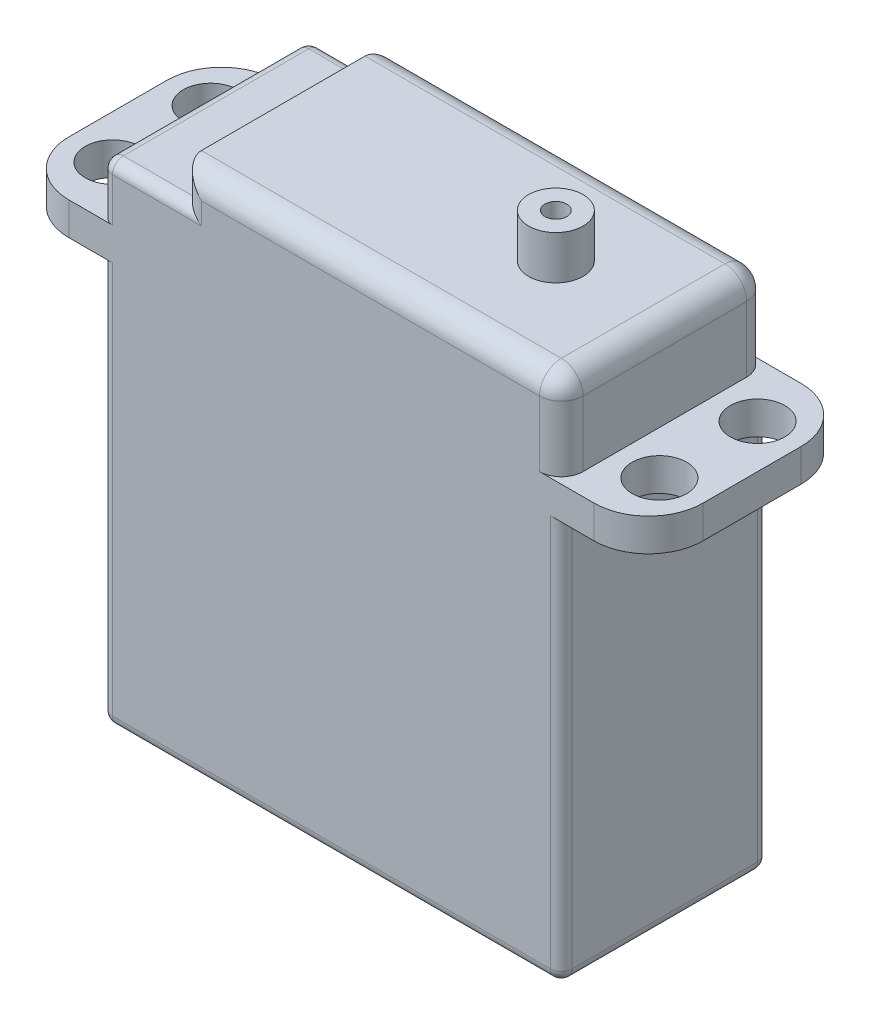
from build123d import *

# Parameters (mm, degrees)
SKETCH1_W           = 42.162271806
SKETCH1_H           = 37
SKETCH1_W_2         = 35
SKETCH1_H_2         = 3
BOSS_EXTRUDE1_DEPTH = 19
SKETCH2_R           = 2.5
CUT_EXTRUDE1_DEPTH  = 19
SKETCH4_R           = 2.5
SKETCH4_R_2         = 1
BOSS_EXTRUDE2_DEPTH = 4
FILLET1_R           = 2
FILLET2_R           = 2
FILLET3_R           = 5
FILLET4_R           = 1
FILLET5_R           = 1


with BuildPart() as part:
    # Sketch1 → Boss-Extrude1 (new body)
    with BuildSketch(Plane.XY):
        with Locations((3.738336714, 20.81643002)):
            Rectangle(SKETCH1_W, SKETCH1_H)
        Polygon((-25.342799189, 39.31643002), (-17.342799189, 39.31643002), (24.819472617, 39.31643002), (32.819472617, 39.31643002), (32.819472617, 42.31643002), (24.819472617, 42.31643002), (-17.342799189, 42.31643002), (-25.342799189, 42.31643002), align=None)
        Polygon((-17.342799189, 47.31643002), (-17.342799189, 42.31643002), (24.819472617, 42.31643002), (24.819472617, 47.31643002), (-10.180527383, 47.31643002), align=None)
        with Locations((7.319472617, 48.81643002)):
            Rectangle(SKETCH1_W_2, SKETCH1_H_2)
    extrude(amount=BOSS_EXTRUDE1_DEPTH)

    # Sketch2 → Cut-Extrude1 (cut)
    with BuildSketch(Plane(origin=(0, 42.31643002, 0), x_dir=(1, 0, 0), z_dir=(0, 1, 0))):
        with Locations(Location((-21.342799189, -14, 0), (0, 0, 270))):
            Circle(SKETCH2_R)
        with Locations(Location((-21.342799189, -5, 0), (0, 0, 270))):
            Circle(SKETCH2_R)
        with Locations(Location((28.819472617, -5, 0), (0, 0, 270))):
            Circle(SKETCH2_R)
        with Locations(Location((28.819472617, -14, 0), (0, 0, 270))):
            Circle(SKETCH2_R)
    extrude(amount=-CUT_EXTRUDE1_DEPTH, mode=Mode.SUBTRACT)

    # Sketch4 → Boss-Extrude2 (add)
    with BuildSketch(Plane(origin=(0, 50.31643002, 0), x_dir=(1, 0, 0), z_dir=(0, 1, 0))):
        with Locations(Location((14.819472617, -9.5, 0), (0, 0, 270))):
            Circle(SKETCH4_R)
        with Locations(Location((14.819472617, -9.5, 0), (0, 0, 270))):
            Circle(SKETCH4_R_2, mode=Mode.SUBTRACT)
    extrude(amount=BOSS_EXTRUDE2_DEPTH)

    # Fillet1
    fillet1_edges = [part.edges().sort_by_distance(p)[0] for p in [
        (-10.180527383, 48.81643002, 0),
        (-10.180527383, 48.81643002, 19),
    ]]
    fillet(fillet1_edges, radius=FILLET1_R)

    # Fillet2
    # the kernel refuses this fillet: 2 mm, written as the material it takes off along each edge
    with BuildSketch(Plane(origin=(22.819472617, 48.31643002, 2), x_dir=(1, 0, 0), z_dir=(0, 0, -1))) as fillet2_piece_1_section:
        Polygon((0, 0), (FILLET2_R * 1.02, 0), (FILLET2_R * 1.02, -FILLET2_R * 1.02), (0, -FILLET2_R * 1.02), align=None)
    fillet2_piece_1 = extrude(amount=FILLET2_R * 1.02, mode=Mode.PRIVATE)
    fillet2_piece_1 = fillet2_piece_1 - Plane(origin=(22.819472617, 48.31643002, 2), x_dir=(-0.7071067811865475, -0.7071067811865475, 0), z_dir=(0, 0, -1)) * Sphere(FILLET2_R, mode=Mode.PRIVATE)
    add(fillet2_piece_1, mode=Mode.SUBTRACT)
    with BuildSketch(Plane(origin=(22.819472617, 48.31643002, 17), x_dir=(0, 0, 1), z_dir=(1, 0, 0))) as fillet2_piece_2_section:
        Polygon((0, 0), (FILLET2_R * 1.02, 0), (FILLET2_R * 1.02, -FILLET2_R * 1.02), (0, -FILLET2_R * 1.02), align=None)
    fillet2_piece_2 = extrude(amount=FILLET2_R * 1.02, mode=Mode.PRIVATE)
    fillet2_piece_2 = fillet2_piece_2 - Plane(origin=(22.819472617, 48.31643002, 17), x_dir=(0, -0.7071067811865475, -0.7071067811865475), z_dir=(1, 0, 0)) * Sphere(FILLET2_R, mode=Mode.PRIVATE)
    add(fillet2_piece_2, mode=Mode.SUBTRACT)
    with BuildSketch(Plane(origin=(22.819472617, 50.31643002, 0), x_dir=(0, -1, 0), z_dir=(-1, 0, 0))) as fillet2_piece_3:
        with BuildLine():
            CenterArc((FILLET2_R, FILLET2_R), FILLET2_R, 180, 90)
            Line((0, FILLET2_R), (0, 0))
            Line((0, 0), (FILLET2_R, 0))
        make_face()
    extrude(amount=36, mode=Mode.SUBTRACT)
    with BuildSketch(Plane(origin=(24.819472617, 48.31643002, 0), x_dir=(-1, 0, 0), z_dir=(0, -1, 0))) as fillet2_piece_4:
        with BuildLine():
            CenterArc((FILLET2_R, -FILLET2_R), FILLET2_R, 90, 90)
            Line((0, -FILLET2_R), (0, 0))
            Line((0, 0), (FILLET2_R, 0))
        make_face()
    extrude(amount=6, mode=Mode.SUBTRACT)
    with BuildSketch(Plane(origin=(24.819472617, 42.31643002, 19), x_dir=(0, 0, -1), z_dir=(0, 1, 0))) as fillet2_piece_5:
        with BuildLine():
            CenterArc((FILLET2_R, FILLET2_R), FILLET2_R, 180, 90)
            Line((0, FILLET2_R), (0, 0))
            Line((0, 0), (FILLET2_R, 0))
        make_face()
    extrude(amount=6, mode=Mode.SUBTRACT)
    with BuildSketch(Plane(origin=(22.819472617, 50.31643002, 19), x_dir=(0, -1, 0), z_dir=(-1, 0, 0))) as fillet2_piece_6:
        with BuildLine():
            CenterArc((FILLET2_R, -FILLET2_R), FILLET2_R, 90, 90)
            Line((0, -FILLET2_R), (0, 0))
            Line((0, 0), (FILLET2_R, 0))
        make_face()
    extrude(amount=36, mode=Mode.SUBTRACT)
    with BuildSketch(Plane(origin=(24.819472617, 50.31643002, 2), x_dir=(0, -1, 0), z_dir=(0, 0, 1))) as fillet2_piece_7:
        with BuildLine():
            CenterArc((FILLET2_R, -FILLET2_R), FILLET2_R, 90, 90)
            Line((0, -FILLET2_R), (0, 0))
            Line((0, 0), (FILLET2_R, 0))
        make_face()
    extrude(amount=15, mode=Mode.SUBTRACT)

    # Fillet3
    fillet3_edges = [part.edges().sort_by_distance(p)[0] for p in [
        (-25.342799189, 40.81643002, 0),
        (32.819472617, 40.81643002, 19),
        (32.819472617, 40.81643002, 0),
        (-25.342799189, 40.81643002, 19),
    ]]
    fillet(fillet3_edges, radius=FILLET3_R)

    # Fillet4
    fillet4_edges = [part.edges().sort_by_distance(p)[0] for p in [
        (-17.342799189, 44.81643002, 0),
        (-12.761663286, 47.31643002, 0),
        (-17.342799189, 47.31643002, 9.5),
        (-12.761663286, 47.31643002, 19),
        (-17.342799189, 44.81643002, 19),
    ]]
    fillet(fillet4_edges, radius=FILLET4_R)

    # Fillet5
    fillet5_edges = [part.edges().sort_by_distance(p)[0] for p in [
        (24.819472617, 20.81643002, 19),
        (-17.342799189, 20.81643002, 0),
        (24.819472617, 20.81643002, 0),
        (3.738336714, 2.31643002, 0),
        (-17.342799189, 2.31643002, 9.5),
        (24.819472617, 2.31643002, 9.5),
        (3.738336714, 2.31643002, 19),
        (-17.342799189, 20.81643002, 19),
    ]]
    fillet(fillet5_edges, radius=FILLET5_R)


solid = part.part
